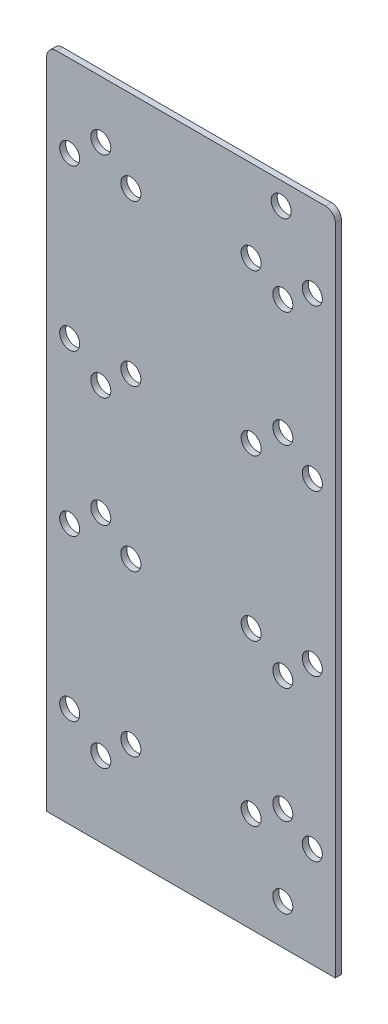
from build123d import *

# Parameters (mm, degrees)
SKETCH1_W           = 144
SKETCH1_H           = 331
BOSS_EXTRUDE1_DEPTH = 3
SKETCH2_R           = 5
CUT_EXTRUDE1_DEPTH  = 543.073379748
SKETCH3_R           = 5
CUT_EXTRUDE2_DEPTH  = 10
SKETCH4_R           = 5
CUT_EXTRUDE3_DEPTH  = 10
LPATTERN1_COUNT     = 4
LPATTERN1_PITCH     = 80
FILLET1_R           = 5


with BuildPart() as part:
    # Sketch1 → Boss-Extrude1 (new body)
    with BuildSketch(Plane.XY.offset(3)):
        with Locations((18.851179955, 368.89742901)):
            Rectangle(SKETCH1_W, SKETCH1_H)
    extrude(amount=-BOSS_EXTRUDE1_DEPTH)

    # Sketch2 → Cut-Extrude1 (cut, through all)
    with BuildSketch(Plane.XY.offset(3)):
        with Locations((63.851179955, 523.39742901)):
            Circle(SKETCH2_R)
        with Locations((64.635907686, 483.39742901)):
            Circle(SKETCH2_R)
        with Locations((64.635907686, 425.89742901)):
            Circle(SKETCH2_R)
        with Locations((64.635907686, 320.89742901)):
            Circle(SKETCH2_R)
        with Locations((64.635907686, 263.39742901)):
            Circle(SKETCH2_R)
        with Locations((64.635907686, 223.39742901)):
            Circle(SKETCH2_R)
    extrude(amount=-CUT_EXTRUDE1_DEPTH, mode=Mode.SUBTRACT)

    # Sketch3 → Cut-Extrude2 (cut)
    with BuildSketch(Plane.XY.offset(3)):
        with Locations((-26.148820045, 505.89742901)):
            Circle(SKETCH3_R)
        with Locations((-26.148820045, 400.89742901)):
            Circle(SKETCH3_R)
        with Locations((-26.148820045, 345.89742901)):
            Circle(SKETCH3_R)
        with Locations((-26.148820045, 240.89742901)):
            Circle(SKETCH3_R)
    extrude(amount=-CUT_EXTRUDE2_DEPTH, mode=Mode.SUBTRACT)

    # Sketch4 → Cut-Extrude3 (cut)
    with BuildSketch(Plane.XY.offset(3)):
        with Locations((-41.648820045, 253.39742901)):
            Circle(SKETCH4_R)
        with Locations((-11.148820045, 253.39742901)):
            Circle(SKETCH4_R)
        with Locations((48.851179955, 253.39742901)):
            Circle(SKETCH4_R)
        with Locations((79.351179955, 253.39742901)):
            Circle(SKETCH4_R)
    cut_extrude3 = extrude(amount=-CUT_EXTRUDE3_DEPTH, mode=Mode.SUBTRACT)

    # LPattern1: Cut-Extrude3 ×4
    with Locations(*[(0, i * LPATTERN1_PITCH, 0) for i in range(1, LPATTERN1_COUNT)]):
        add(cut_extrude3, mode=Mode.SUBTRACT)

    # Fillet1
    fillet1_edges = [part.edges().sort_by_distance(p)[0] for p in [
        (90.851179955, 534.39742901, 1.5),
        (-53.148820045, 534.39742901, 1.5),
    ]]
    fillet(fillet1_edges, radius=FILLET1_R)


solid = part.part
